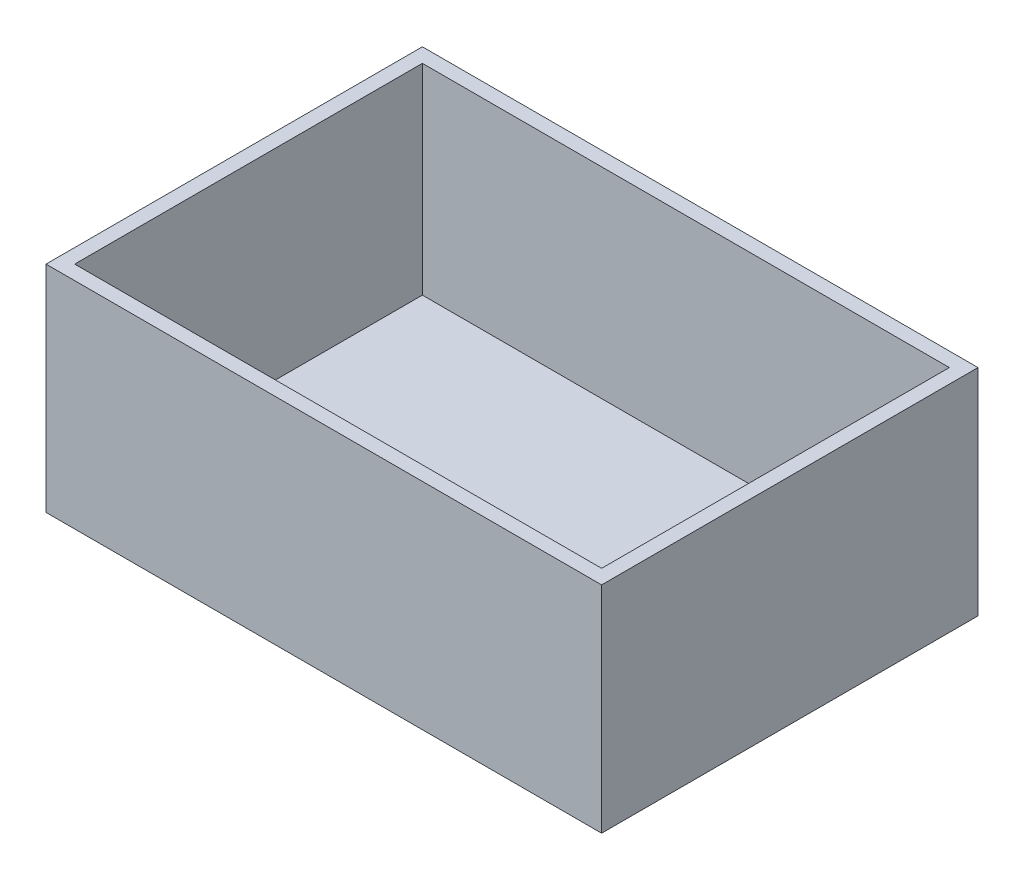
from build123d import *

# Parameters (mm, degrees)
CROQUIS1_W              = 77.5
CROQUIS1_H              = 52.5
SALIENTE_EXTRUIR1_DEPTH = 30
VACIADO1_T              = -2


with BuildPart() as part:
    # Croquis1 → Saliente-Extruir1 (new body)
    with BuildSketch(Plane(origin=(0, 0, 0), x_dir=(1, 0, 0), z_dir=(0, 1, 0))):
        Rectangle(CROQUIS1_W, CROQUIS1_H)
    extrude(amount=SALIENTE_EXTRUIR1_DEPTH)

    # Vaciado1
    vaciado1_openings = [part.faces().sort_by_distance(p)[0] for p in [
        (0, 30, 0),
    ]]
    offset(amount=VACIADO1_T, openings=vaciado1_openings, kind=Kind.INTERSECTION)


solid = part.part
